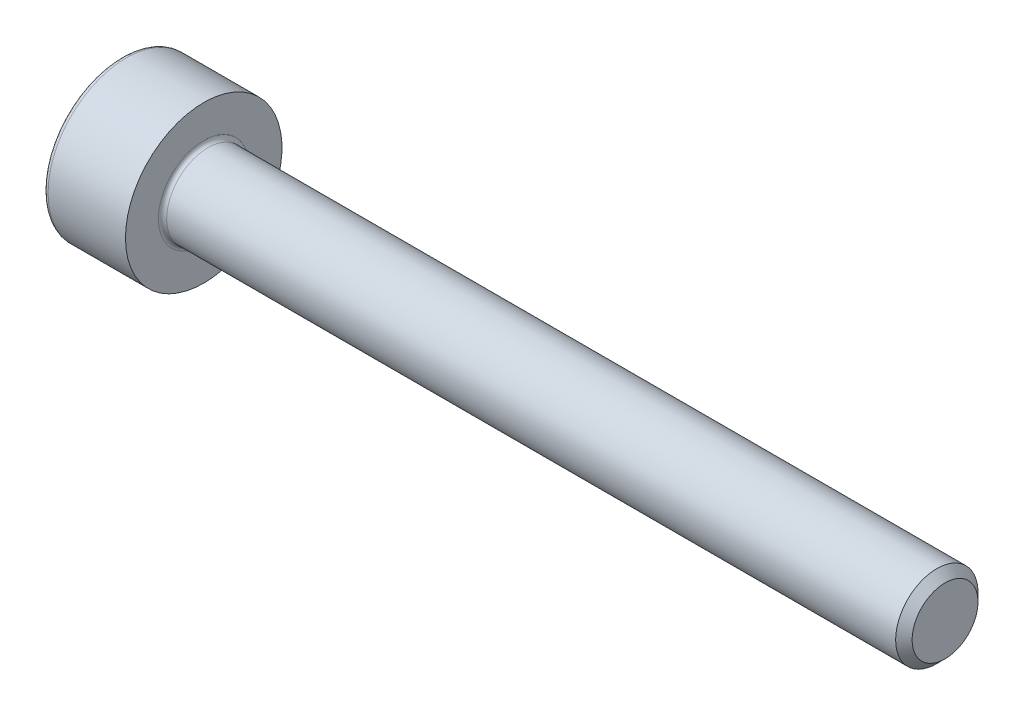
from build123d import *

# Parameters (mm, degrees)
FILLET1_R      = 0.1
FILLET2_R      = 0.12
CHAMFER1_SIZE  = 0.2
EXTRUDE1_DEPTH = 1


with BuildPart() as part:
    # Sketch1 → Revolve1 (revolve)
    with BuildSketch(Plane.XY):
        Polygon((0, 1.9), (0, 0), (20, 0), (20, 1), (2, 1), (2, 1.9), align=None)
    revolve(axis=Axis((0, 0, 0), (1, 0, 0)))

    # Fillet1
    fillet1_edges = [part.edges().sort_by_distance(p)[0] for p in [
        (2, -1, 0),
    ]]
    fillet(fillet1_edges, radius=FILLET1_R)

    # Fillet2
    fillet2_edges = [part.edges().sort_by_distance(p)[0] for p in [
        (0, -1.9, 0),
    ]]
    fillet(fillet2_edges, radius=FILLET2_R)

    # Chamfer1
    chamfer1_edges = [part.edges().sort_by_distance(p)[0] for p in [
        (20, -1, 0),
    ]]
    chamfer(chamfer1_edges, length=CHAMFER1_SIZE)

    # Sketch2 → Extrude1 (cut)
    with BuildSketch(Plane.ZY):
        Polygon((0, 0.866025404), (-0.75, 0.433012702), (-0.75, -0.433012702), (0, -0.866025404), (0.75, -0.433012702), (0.75, 0.433012702), align=None)
    extrude(amount=-EXTRUDE1_DEPTH, mode=Mode.SUBTRACT)


solid = part.part
